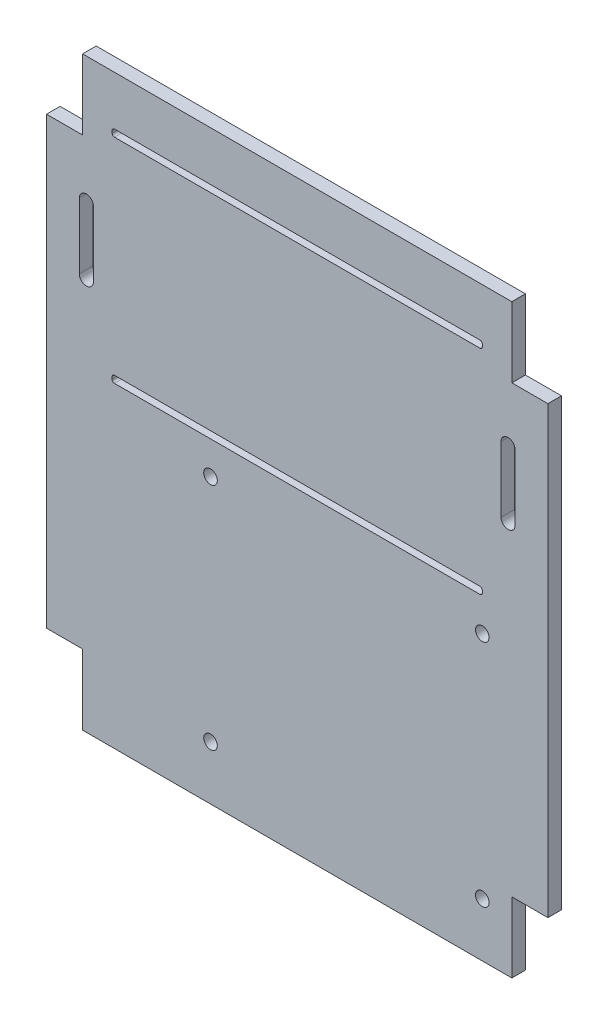
from build123d import *

# Parameters (mm, degrees)
SKETCH1_R           = 1.45
BOSS_EXTRUDE2_DEPTH = 2.9


with BuildPart() as part:
    # Sketch1 → Boss-Extrude2 (new body)
    with BuildSketch(Plane.XY):
        Polygon((-53.5, 0), (-45.801952589, 0), (-45.801952589, -15), (45.801952589, -15), (45.801952589, 0), (53.5, 0), (53.5, 95), (45.801952589, 95), (45.801952589, 110), (-45.801952589, 110), (-45.801952589, 95), (-53.5, 95), align=None)
        with Locations((39.5, -3.5)):
            Circle(SKETCH1_R, mode=Mode.SUBTRACT)
        with Locations((39.5, 45.5)):
            Circle(SKETCH1_R, mode=Mode.SUBTRACT)
        with Locations((-18.5, -3.5)):
            Circle(SKETCH1_R, mode=Mode.SUBTRACT)
        with Locations((-18.5, 45.5)):
            Circle(SKETCH1_R, mode=Mode.SUBTRACT)
        with BuildLine():
            Line((-39, 98), (39, 98))
            ThreePointArc((39, 98), (39.353553391, 98.146446609), (39.5, 98.5))
            Line((39.5, 98.5), (39.5, 99))
            ThreePointArc((39.5, 99), (39.353553391, 99.353553391), (39, 99.5))
            Line((39, 99.5), (-39, 99.5))
            ThreePointArc((-39, 99.5), (-39.353553391, 99.353553391), (-39.5, 99))
            Line((-39.5, 99), (-39.5, 98.5))
            ThreePointArc((-39.5, 98.5), (-39.353553391, 98.146446609), (-39, 98))
        make_face(mode=Mode.SUBTRACT)
        with BuildLine():
            Line((-39, 52.5), (39, 52.5))
            ThreePointArc((39, 52.5), (39.353553391, 52.646446609), (39.5, 53))
            Line((39.5, 53), (39.5, 53.5))
            ThreePointArc((39.5, 53.5), (39.353553391, 53.853553391), (39, 54))
            Line((39, 54), (-39, 54))
            ThreePointArc((-39, 54), (-39.353553391, 53.853553391), (-39.5, 53.5))
            Line((-39.5, 53.5), (-39.5, 53))
            ThreePointArc((-39.5, 53), (-39.353553391, 52.646446609), (-39, 52.5))
        make_face(mode=Mode.SUBTRACT)
        with BuildLine():
            Line((-43.5, 83), (-43.5, 69))
            ThreePointArc((-43.5, 69), (-45, 67.5), (-46.5, 69))
            Line((-46.5, 69), (-46.5, 83))
            ThreePointArc((-46.5, 83), (-45, 84.5), (-43.5, 83))
        make_face(mode=Mode.SUBTRACT)
        with BuildLine():
            Line((43.5, 83), (43.5, 69))
            ThreePointArc((43.5, 69), (45, 67.5), (46.5, 69))
            Line((46.5, 69), (46.5, 83))
            ThreePointArc((46.5, 83), (45, 84.5), (43.5, 83))
        make_face(mode=Mode.SUBTRACT)
    extrude(amount=BOSS_EXTRUDE2_DEPTH)


solid = part.part
